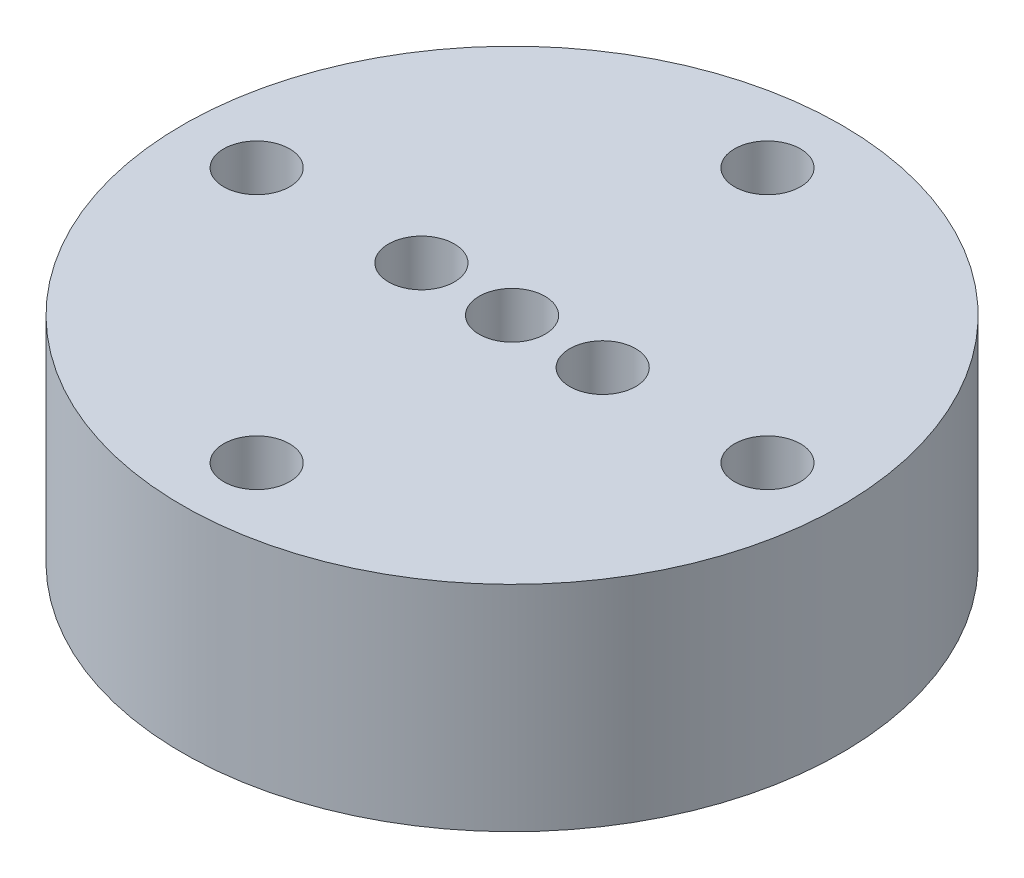
from build123d import *

# Parameters (mm, degrees)
SKETCH1_R           = 20
SKETCH1_R_2         = 2
BOSS_EXTRUDE1_DEPTH = 13
SKETCH2_R           = 2
CUT_EXTRUDE1_DEPTH  = 32.128764833


with BuildPart() as part:
    # Sketch1 → Boss-Extrude1 (new body)
    with BuildSketch(Plane(origin=(0, 0, 0), x_dir=(1, 0, 0), z_dir=(0, 1, 0))):
        Circle(SKETCH1_R)
        with Locations((0, 15.5)):
            Circle(SKETCH1_R_2, mode=Mode.SUBTRACT)
        with Locations((15.5, 0)):
            Circle(SKETCH1_R_2, mode=Mode.SUBTRACT)
        with Locations((0, -15.5)):
            Circle(SKETCH1_R_2, mode=Mode.SUBTRACT)
        with Locations((-15.5, 0)):
            Circle(SKETCH1_R_2, mode=Mode.SUBTRACT)
    extrude(amount=BOSS_EXTRUDE1_DEPTH)

    # Sketch2 → Cut-Extrude1 (cut, through all)
    with BuildSketch(Plane(origin=(0, 13, 0), x_dir=(1, 0, 0), z_dir=(0, 1, 0))):
        Circle(SKETCH2_R)
        with Locations((5.5, 0)):
            Circle(SKETCH2_R)
        with Locations((-5.5, 0)):
            Circle(SKETCH2_R)
    extrude(amount=-CUT_EXTRUDE1_DEPTH, mode=Mode.SUBTRACT)


solid = part.part
